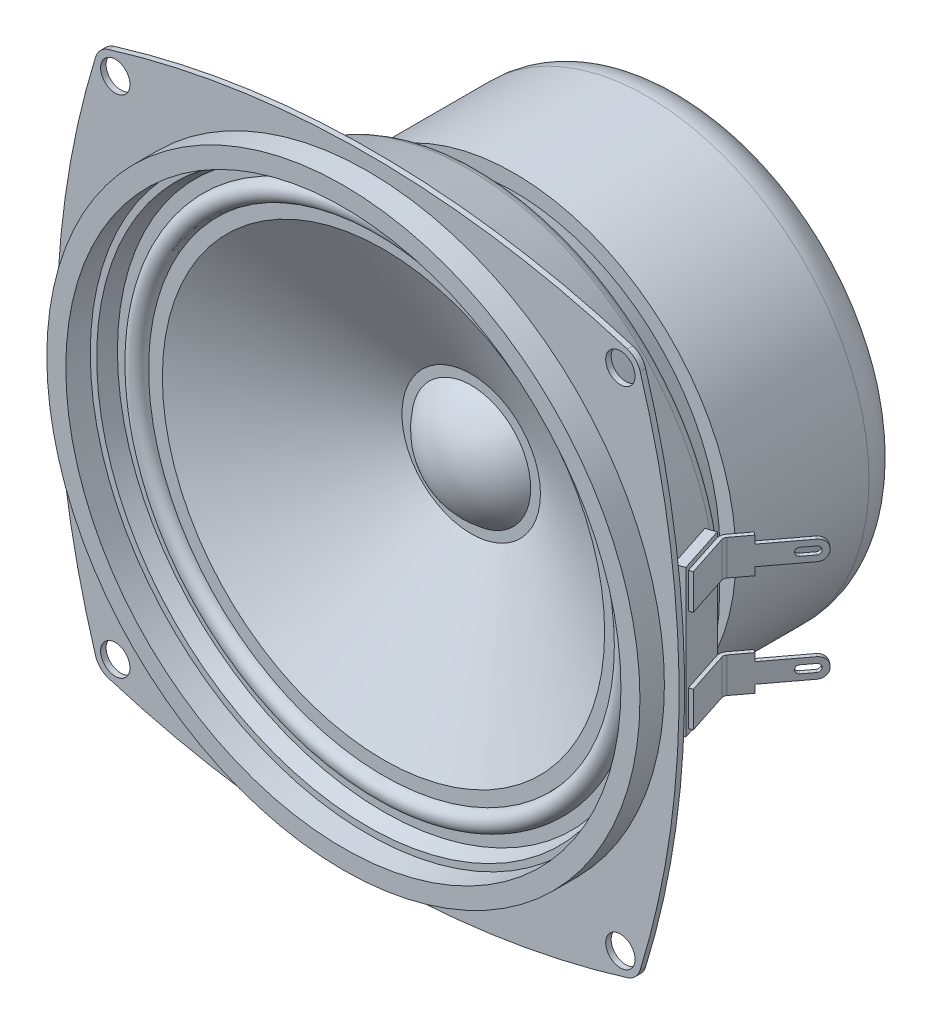
from build123d import *

# Parameters (mm, degrees)
SKETCH3_R          = 28.7528
EXTRUDE1_DEPTH     = 22.352
FILLET1_R          = 5.08
SKETCH4_R          = 26.67
EXTRUDE2_DEPTH     = 4.318
EXTRUDE2_DRAFT     = -20
SKETCH5_R          = 31.75
EXTRUDE3_DEPTH     = 13.97
EXTRUDE3_DRAFT     = -18
EXTRUDE4_DEPTH     = 0.7112
SKETCH8_R          = 38.481
SKETCH8_R_2        = 36.0172
EXTRUDE5_DEPTH     = 3.175
SKETCH9_R          = 9.3345
CUT_EXTRUDE1_DEPTH = 1.016
FILLET2_R          = 1.016
SKETCH10_R         = 1.905
CUT_EXTRUDE2_DEPTH = 71.097557675
FILLET3_R          = 2.54
SKETCH12_W         = 19.05
SKETCH12_H         = 6.35
EXTRUDE6_DEPTH     = 1.27
EXTRUDE7_DEPTH     = 4.572
SKETCH14_W         = 6.985
SKETCH14_H         = 1.016
CUT_EXTRUDE3_DEPTH = 0.508
FILLET4_R          = 1.2446
CUT_EXTRUDE4_DEPTH = 0.508
FILLET5_R          = 1.27
FILLET6_R          = 0.635


# Some blends are built 0.0001 mm under size
with BuildPart() as part:
    # Sketch3 → Extrude1 (new body)
    with BuildSketch(Plane.XY):
        Circle(SKETCH3_R)
    extrude(amount=EXTRUDE1_DEPTH)

    # Fillet1
    fillet1_edges = [part.edges().sort_by_distance(p)[0] for p in [
        (-28.7528, 0, 0),
    ]]
    fillet(fillet1_edges, radius=FILLET1_R)


with BuildPart() as extrude2_tool:
    # Sketch4 → Extrude2 (with draft: the straight prism first)
    with BuildSketch(Plane.XY.offset(22.352)):
        Circle(SKETCH4_R)
    extrude(amount=EXTRUDE2_DEPTH)
    # Extrude2: the draft: its side faces are tilted about the plane it starts from
    extrude2_sides = [extrude2_tool.faces().sort_by_distance(p)[0] for p in [
        (-26.67, 0, 24.511),
    ]]
    draft(extrude2_sides, Plane.XY.offset(22.352), EXTRUDE2_DRAFT)


with BuildPart() as part_1:
    add(part.part)

    # Extrude2: add extrude2_tool
    add(extrude2_tool.part)


with BuildPart() as extrude3_tool:
    # Sketch5 → Extrude3 (with draft: the straight prism first)
    with BuildSketch(Plane.XY.offset(26.67)):
        Circle(SKETCH5_R)
    extrude(amount=EXTRUDE3_DEPTH)
    # Extrude3: the draft: its side faces are tilted about the plane it starts from
    extrude3_sides = [extrude3_tool.faces().sort_by_distance(p)[0] for p in [
        (-31.75, 0, 33.655),
    ]]
    draft(extrude3_sides, Plane.XY.offset(26.67), EXTRUDE3_DRAFT)


with BuildPart() as part_2:
    add(part_1.part)

    # Extrude3: add extrude3_tool
    add(extrude3_tool.part)

    # Sketch7 → Extrude4 (add)
    with BuildSketch(Plane.XY.offset(40.64)):
        with BuildLine():
            ThreePointArc((33.646038655, 35.326742513), (0, 40.386), (-33.646038655, 35.326742513))
            ThreePointArc((-33.646038655, 35.326742513), (-34.695114294, 34.695114294), (-35.326742513, 33.646038655))
            ThreePointArc((-35.326742513, 33.646038655), (-40.386, 0), (-35.326742513, -33.646038655))
            ThreePointArc((-35.326742513, -33.646038655), (-34.695114294, -34.695114294), (-33.646038655, -35.326742513))
            ThreePointArc((-33.646038655, -35.326742513), (0, -40.386), (33.646038655, -35.326742513))
            ThreePointArc((33.646038655, -35.326742513), (34.695114294, -34.695114294), (35.326742513, -33.646038655))
            ThreePointArc((35.326742513, -33.646038655), (40.386, 0), (35.326742513, 33.646038655))
            ThreePointArc((35.326742513, 33.646038655), (34.695114294, 34.695114294), (33.646038655, 35.326742513))
        make_face()
    extrude(amount=EXTRUDE4_DEPTH)

    # Sketch8 → Extrude5 (add)
    with BuildSketch(Plane.XY.offset(41.3512)):
        Circle(SKETCH8_R)
        Circle(SKETCH8_R_2, mode=Mode.SUBTRACT)
    extrude(amount=EXTRUDE5_DEPTH)

    # Sketch9 → Cut-Extrude1 (cut)
    with BuildSketch(Plane(origin=(0, 0, 0), x_dir=(-1, 0, 0), z_dir=(0, 0, -1))):
        Circle(SKETCH9_R)
    extrude(amount=-CUT_EXTRUDE1_DEPTH, mode=Mode.SUBTRACT)

    # Fillet2
    fillet2_edges = [part_2.edges().sort_by_distance(p)[0] for p in [
        (9.3345, 0, 0),
    ]]
    fillet(fillet2_edges, radius=FILLET2_R - 0.0001)  # a hair under: the kernel refuses the full size

    # Sketch10 → Cut-Extrude2 (cut, through all)
    with BuildSketch(Plane(origin=(0, 0, 40.64), x_dir=(-1, 0, 0), z_dir=(0, 0, -1))):
        with Locations((-32.766, 32.766)):
            Circle(SKETCH10_R)
        with Locations((32.766, 32.766)):
            Circle(SKETCH10_R)
        with Locations((32.766, -32.766)):
            Circle(SKETCH10_R)
        with Locations((-32.766, -32.766)):
            Circle(SKETCH10_R)
    extrude(amount=-CUT_EXTRUDE2_DEPTH, mode=Mode.SUBTRACT)

    # Fillet3
    fillet3_edges = [part_2.edges().sort_by_distance(p)[0] for p in [
        (-31.75, 0, 26.67),
    ]]
    fillet(fillet3_edges, radius=FILLET3_R)

    # Sketch11 → Cut-Revolve1 (revolve, cut)
    with BuildSketch(Plane(origin=(0, 0, 0), x_dir=(1, 0, 0), z_dir=(0, 1, 0))):
        with BuildLine():
            Line((0, -41.3512), (35.18485402, -41.3512))
            Line((35.18485402, -41.3512), (34.524617197, -39.3192))
            Line((34.524617197, -39.3192), (33.02, -39.3192))
            ThreePointArc((33.02, -39.3192), (31.75, -40.5892), (30.48, -39.3192))
            Line((30.48, -39.3192), (28.692969146, -39.3192))
            Line((28.692969146, -39.3192), (8.983616597, -27.94))
            Line((8.983616597, -27.94), (7.713616597, -27.94))
            ThreePointArc((7.713616597, -27.94), (4.330122689, -30.835847152), (0, -31.877))
            Line((0, -31.877), (0, -41.3512))
        make_face()
    revolve(axis=Axis((0, 0, 54.369202761), (0, 0, -1)), mode=Mode.SUBTRACT)


with BuildPart() as body_2:
    # Sketch12 → Extrude6 (new body)
    with BuildSketch(Plane(origin=(34.304696843, 0, 34.532548417), x_dir=(0, -1, 0), z_dir=(0.9510565162951533, 0, -0.30901699437494806))):
        with Locations((0, 0.898139508)):
            Rectangle(SKETCH12_W, SKETCH12_H)
    extrude(amount=EXTRUDE6_DEPTH)

    # Sketch13 → Extrude7 (add)
    with BuildSketch(Plane(origin=(0, 8.89, 0), x_dir=(-1, 0, 0), z_dir=(0, 1, 0))):
        Polygon((-34.096888657, 29.783174253), (-36.059146572, 35.822383132), (-36.542283282, 35.665402499), (-34.661744313, 29.877698672), (-40.617036132, 21.974759503), (-40.211329293, 21.669037471), align=None)
    extrude7 = extrude(amount=-EXTRUDE7_DEPTH)

    # Mirror1: Extrude7 across plane
    add(extrude7.mirror(Plane.ZX))

    # Sketch14 → Cut-Extrude3 (cut)
    with BuildSketch(Plane(origin=(36.46805158, 0, 27.480647967), x_dir=(0.6018150231520509, 0, -0.7986355100472909), z_dir=(0.7986355100472908, 0, 0.6018150231520508))):
        with Locations((3.401619276, 8.382)):
            Rectangle(SKETCH14_W, SKETCH14_H)
        with Locations((3.401619276, 4.826)):
            Rectangle(SKETCH14_W, SKETCH14_H)
        with Locations((3.401619276, -4.826)):
            Rectangle(SKETCH14_W, SKETCH14_H)
        with Locations((3.401619276, -8.382)):
            Rectangle(SKETCH14_W, SKETCH14_H)
    extrude(amount=-CUT_EXTRUDE3_DEPTH, mode=Mode.SUBTRACT)

    # Fillet4
    fillet4_edges = [body_2.edges().sort_by_distance(p)[0] for p in [
        (40.414182712, 7.874, 21.821898487),
        (40.414182712, 5.334, 21.821898487),
        (40.414182712, -5.334, 21.821898487),
        (40.414182712, -7.874, 21.821898487),
    ]]
    fillet(fillet4_edges, radius=FILLET4_R)

    # Sketch15 → Cut-Extrude4 (cut)
    with BuildSketch(Plane(origin=(36.46805158, 0, 27.480647967), x_dir=(0.6018150231520509, 0, -0.7986355100472909), z_dir=(0.7986355100472908, 0, 0.6018150231520508))):
        with BuildLine():
            Line((6.132119276, 6.5786), (6.132119276, 6.6294))
            ThreePointArc((6.132119276, 6.6294), (5.990769009, 6.970649733), (5.649519276, 7.112))
            Line((5.649519276, 7.112), (4.074719276, 7.112))
            ThreePointArc((4.074719276, 7.112), (3.733469544, 6.970649733), (3.592119276, 6.6294))
            Line((3.592119276, 6.6294), (3.592119276, 6.5786))
            ThreePointArc((3.592119276, 6.5786), (3.733469544, 6.237350267), (4.074719276, 6.096))
            Line((4.074719276, 6.096), (5.649519276, 6.096))
            ThreePointArc((5.649519276, 6.096), (5.990769009, 6.237350267), (6.132119276, 6.5786))
        make_face()
    cut_extrude4 = extrude(amount=-CUT_EXTRUDE4_DEPTH, mode=Mode.SUBTRACT)

    # Mirror2: Cut-Extrude4 across plane
    add(cut_extrude4.mirror(Plane.ZX), mode=Mode.SUBTRACT)

    # Fillet5
    # the kernel refuses this fillet: 1.27 mm, written as the material it takes off along each edge
    with BuildSketch(Plane(origin=(34.096888657, 10.511830148, 29.783174253), x_dir=(0.6018150231520495, 0, -0.7986355100472919), z_dir=(0, -1, 0))) as fillet5_piece_1:
        with BuildLine():
            CenterArc((0.648732059, 1.27), FILLET5_R, 222.247861742, 47.752138258)
            Line((-0.29137683, 0.416129238), (-0.310179007, 0.399051823))
            ThreePointArc((-0.310179007, 0.399051823), (-0.166494877, 0.193495778), (-0.020806462, -0.014568841))
            Line((-0.020806462, -0.014568841), (0, -0.0254))
            Line((0, -0.0254), (0.648732059, -0.0254))
            Line((0.648732059, -0.0254), (0.648732059, 0))
        make_face()
    extrude(amount=7.815660295, mode=Mode.SUBTRACT)
    with BuildSketch(Plane(origin=(34.096888657, -10.511830148, 29.783174253), x_dir=(0.30901699437495045, 0, 0.9510565162951525), z_dir=(0, 1, 0))) as fillet5_piece_2:
        with BuildLine():
            CenterArc((0.668225674, 1.259852267), FILLET5_R, 215, 47.752138258)
            Line((-0.372097423, 0.531410192), (-0.392903885, 0.516841351))
            Line((-0.392903885, 0.516841351), (-0.020806462, -0.014568841))
            Line((-0.020806462, -0.014568841), (0, -0.0254))
            ThreePointArc((0, -0.0254), (0.254, -0.0254), (0.504795487, -0.025197045))
            Line((0.504795487, -0.025197045), (0.508, 0))
        make_face()
    extrude(amount=7.815660295, mode=Mode.SUBTRACT)

    # Fillet6
    fillet6_edges = [body_2.edges().sort_by_distance(p)[0] for p in [
        (34.661744313, 6.604, 29.877698672),
        (34.661744313, -6.604, 29.877698672),
    ]]
    fillet(fillet6_edges, radius=FILLET6_R)


solid = Compound([part_2.part, body_2.part])
